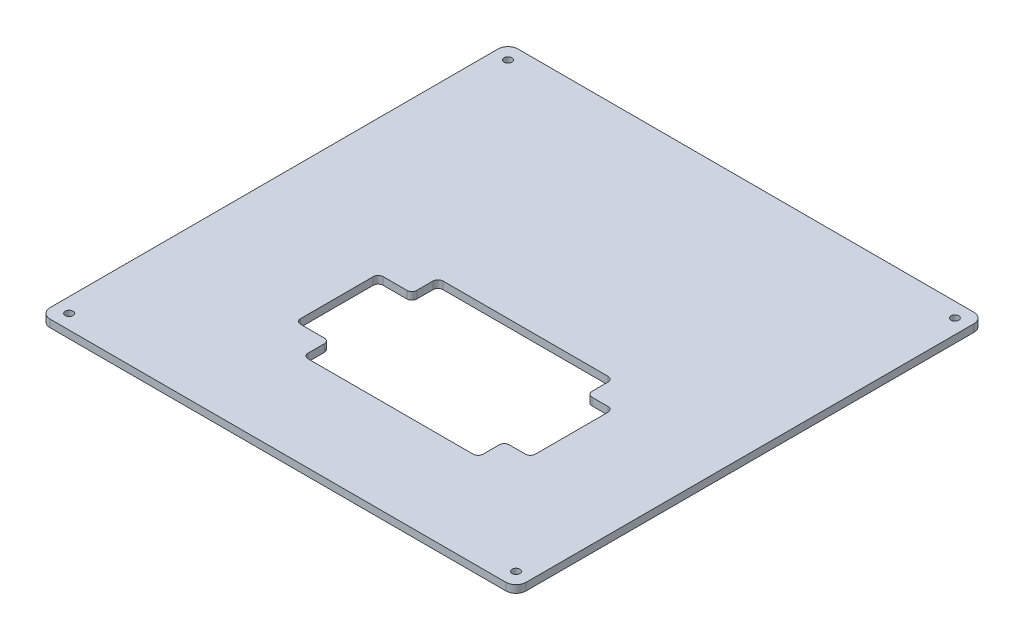
from build123d import *

# Parameters (mm, degrees)
SKETCH1_W           = 190.18
SKETCH1_H           = 186.98
BOSS_EXTRUDE1_DEPTH = 3
CUT_EXTRUDE1_REACH  = 137.214
SKETCH2_W           = 90.83
SKETCH2_H           = 53.9
SKETCH3_W           = 10.45
SKETCH3_H           = 10.45
BOSS_EXTRUDE2_DEPTH = 3
CUT_EXTRUDE2_REACH  = 137.214
SKETCH4_W           = 3
SKETCH4_H           = 33
CUT_EXTRUDE3_REACH  = 137.214
SKETCH5_R           = 1.55
FILLET2_R           = 4
FILLET3_R           = 2


with BuildPart() as part:
    # Sketch1 → Boss-Extrude1 (new body)
    with BuildSketch(Plane(origin=(0, 0, 0), x_dir=(1, 0, 0), z_dir=(0, 1, 0))):
        with Locations((2.55, 0)):
            Rectangle(SKETCH1_W, SKETCH1_H)
    extrude(amount=BOSS_EXTRUDE1_DEPTH)

    # Sketch2 → Cut-Extrude1 (cut, up to next)
    with BuildSketch(Plane.XZ, mode=Mode.PRIVATE) as cut_extrude1_sk1:
        with Locations((9.735, 28.74)):
            Rectangle(SKETCH2_W, SKETCH2_H)
    cut_extrude1_tool1 = extrude(cut_extrude1_sk1.sketch, amount=-CUT_EXTRUDE1_REACH, mode=Mode.PRIVATE) & part.part
    add(cut_extrude1_tool1.solids().sort_by_distance((9.735, 0, 28.74))[0], mode=Mode.SUBTRACT)

    # Sketch3 → Boss-Extrude2 (add)
    with BuildSketch(Plane.XZ):
        with Locations((-30.455, 50.465)):
            Rectangle(SKETCH3_W, SKETCH3_H)
        with Locations((-30.455, 7.015)):
            Rectangle(SKETCH3_W, SKETCH3_H)
        with Locations((49.925, 50.465)):
            Rectangle(SKETCH3_W, SKETCH3_H)
        with Locations((49.925, 7.015)):
            Rectangle(SKETCH3_W, SKETCH3_H)
    extrude(amount=-BOSS_EXTRUDE2_DEPTH)

    # Sketch4 → Cut-Extrude2 (cut, up to next)
    with BuildSketch(Plane.XZ, mode=Mode.PRIVATE) as cut_extrude2_sk1:
        with Locations((-37.18, 28.74)):
            Rectangle(SKETCH4_W, SKETCH4_H)
    cut_extrude2_tool1 = extrude(cut_extrude2_sk1.sketch, amount=-CUT_EXTRUDE2_REACH, mode=Mode.PRIVATE) & part.part
    add(cut_extrude2_tool1.solids().sort_by_distance((-37.18, 0, 28.74))[0], mode=Mode.SUBTRACT)

    # Sketch5 → Cut-Extrude3 (cut, up to next)
    with BuildSketch(Plane.XZ, mode=Mode.PRIVATE) as cut_extrude3_sk1:
        with Locations((-86.74, 87.69)):
            Circle(SKETCH5_R)
    cut_extrude3_tool1 = extrude(cut_extrude3_sk1.sketch, amount=-CUT_EXTRUDE3_REACH, mode=Mode.PRIVATE) & part.part
    # Sketch5 → Cut-Extrude3 (cut, up to next)
    with BuildSketch(Plane.XZ, mode=Mode.PRIVATE) as cut_extrude3_sk2:
        with Locations((91.84, 87.69)):
            Circle(SKETCH5_R)
    cut_extrude3_tool2 = extrude(cut_extrude3_sk2.sketch, amount=-CUT_EXTRUDE3_REACH, mode=Mode.PRIVATE) & part.part
    # Sketch5 → Cut-Extrude3 (cut, up to next)
    with BuildSketch(Plane.XZ, mode=Mode.PRIVATE) as cut_extrude3_sk3:
        with Locations((-86.74, -87.69)):
            Circle(SKETCH5_R)
    cut_extrude3_tool3 = extrude(cut_extrude3_sk3.sketch, amount=-CUT_EXTRUDE3_REACH, mode=Mode.PRIVATE) & part.part
    # Sketch5 → Cut-Extrude3 (cut, up to next)
    with BuildSketch(Plane.XZ, mode=Mode.PRIVATE) as cut_extrude3_sk4:
        with Locations((91.84, -87.69)):
            Circle(SKETCH5_R)
    cut_extrude3_tool4 = extrude(cut_extrude3_sk4.sketch, amount=-CUT_EXTRUDE3_REACH, mode=Mode.PRIVATE) & part.part
    add(cut_extrude3_tool1.solids().sort_by_distance((-86.74, 0, 87.69))[0], mode=Mode.SUBTRACT)
    add(cut_extrude3_tool2.solids().sort_by_distance((91.84, 0, 87.69))[0], mode=Mode.SUBTRACT)
    add(cut_extrude3_tool3.solids().sort_by_distance((-86.74, 0, -87.69))[0], mode=Mode.SUBTRACT)
    add(cut_extrude3_tool4.solids().sort_by_distance((91.84, 0, -87.69))[0], mode=Mode.SUBTRACT)

    # Fillet2
    fillet2_edges = [part.edges().sort_by_distance(p)[0] for p in [
        (-92.54, 1.5, 93.49),
        (97.64, 1.5, 93.49),
        (97.64, 1.5, -93.49),
        (-92.54, 1.5, -93.49),
    ]]
    fillet(fillet2_edges, radius=FILLET2_R)

    # Fillet3
    fillet3_edges = [part.edges().sort_by_distance(p)[0] for p in [
        (-25.23, 1.5, 1.79),
        (-25.23, 1.5, 12.24),
        (-38.68, 1.5, 12.24),
        (-38.68, 1.5, 45.24),
        (-25.23, 1.5, 45.24),
        (-25.23, 1.5, 55.69),
        (44.7, 1.5, 1.79),
        (44.7, 1.5, 12.24),
        (55.15, 1.5, 12.24),
        (55.15, 1.5, 45.24),
        (44.7, 1.5, 45.24),
        (44.7, 1.5, 55.69),
    ]]
    fillet(fillet3_edges, radius=FILLET3_R)


solid = part.part
